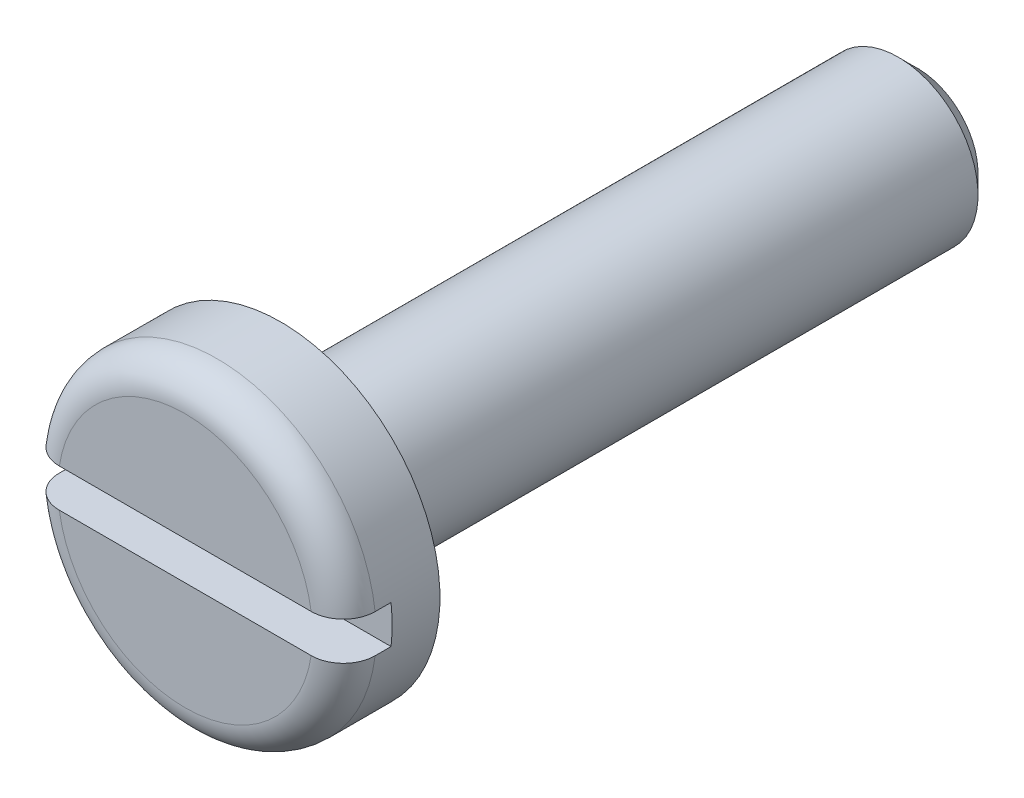
from build123d import *

# Parameters (mm, degrees)
CUT_EXTRUDE_1_DEPTH      = 25.062418831
CUT_EXTRUDE_1_DEPTH_BACK = 25.062418831
SKETCH_2_W               = 1.5
SKETCH_2_H               = 1.2
CHAMFER_1_SIZE           = 0.6
FILLET_1_R               = 1
FILLET_2_R               = 0.4


with BuildPart() as part:
    # Эскиз1 → Повернуть1 (revolve)
    with BuildSketch(Plane(origin=(0, 0, 0), x_dir=(1, 0, 0), z_dir=(0, 1, 0))):
        Polygon((0, 0), (-5, 0), (-5, 3), (-2.5, 3), (-2.5, 23), (0, 23), align=None)
    revolve(axis=Axis((0, 0, -23), (0, 0, 1)))

    # Эскиз2 → Вырез-Вытянуть1 (cut, two sides: drawn at the far end of the back side and taken through both)
    with BuildSketch(Plane(origin=(0, 0, 0), x_dir=(0, 0, -1), z_dir=(1, 0, 0)).offset(-CUT_EXTRUDE_1_DEPTH_BACK)):
        with Locations((0.75, 0)):
            Rectangle(SKETCH_2_W, SKETCH_2_H)
    extrude(amount=CUT_EXTRUDE_1_DEPTH + CUT_EXTRUDE_1_DEPTH_BACK, mode=Mode.SUBTRACT)

    # Фаска1
    chamfer_1_edges = [part.edges().sort_by_distance(p)[0] for p in [
        (2.5, 0, -23),
    ]]
    chamfer(chamfer_1_edges, length=CHAMFER_1_SIZE)

    # Скругление1
    fillet_1_edges = [part.edges().sort_by_distance(p)[0] for p in [
        (0, -5, 0),
        (0, 5, 0),
    ]]
    fillet(fillet_1_edges, radius=FILLET_1_R)

    # Скругление2
    fillet_2_edges = [part.edges().sort_by_distance(p)[0] for p in [
        (2.5, 0, -3),
    ]]
    fillet(fillet_2_edges, radius=FILLET_2_R)


solid = part.part
